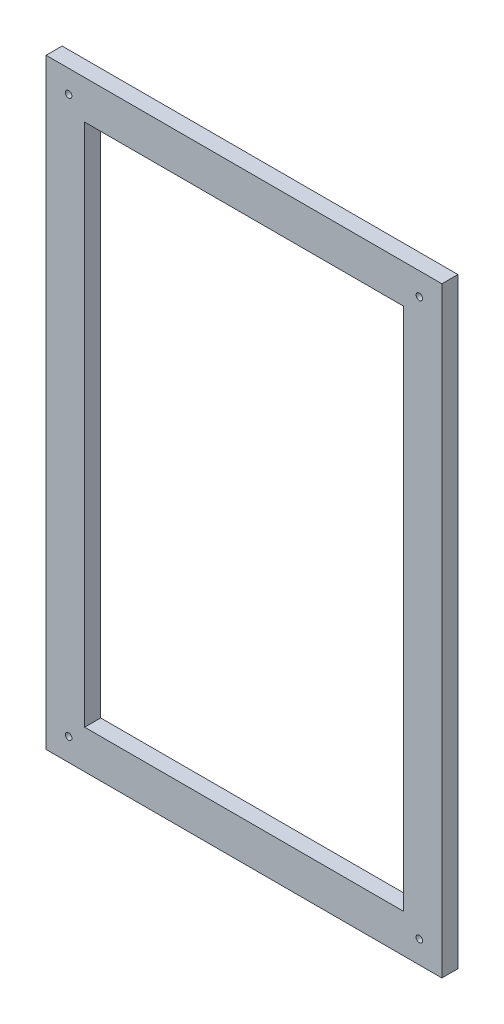
from build123d import *

# Parameters (mm, degrees)
SKETCH1_W            = 395
SKETCH1_H            = 600
BASE_DEPTH           = 16
SKETCH2_R            = 3.25
MOUNTING_HOLES_DEPTH = 719.526965395
CENTER_HOLE_REACH    = 720.527
SKETCH3_W            = 318
SKETCH3_H            = 523


with BuildPart() as part:
    # Sketch1 → Base (new body)
    with BuildSketch(Plane.XY):
        with Locations((197.5, 300)):
            Rectangle(SKETCH1_W, SKETCH1_H)
    extrude(amount=BASE_DEPTH)

    # Sketch2 → Mounting holes (cut, through all)
    with BuildSketch(Plane.XY.offset(16)):
        with Locations((22.5, 577.5)):
            Circle(SKETCH2_R)
        with Locations((372.5, 577.5)):
            Circle(SKETCH2_R)
        with Locations((372.5, 22.5)):
            Circle(SKETCH2_R)
        with Locations((22.5, 22.5)):
            Circle(SKETCH2_R)
    extrude(amount=-MOUNTING_HOLES_DEPTH, mode=Mode.SUBTRACT)

    # Sketch3 → Center hole (cut, up to next)
    with BuildSketch(Plane(origin=(0, 0, 0), x_dir=(-1, 0, 0), z_dir=(0, 0, -1)), mode=Mode.PRIVATE) as center_hole_sk1:
        with Locations((-197.5, 300)):
            Rectangle(SKETCH3_W, SKETCH3_H)
    center_hole_tool1 = extrude(center_hole_sk1.sketch, amount=-CENTER_HOLE_REACH, mode=Mode.PRIVATE) & part.part
    add(center_hole_tool1.solids().sort_by_distance((197.5, 300, 0))[0], mode=Mode.SUBTRACT)


solid = part.part
